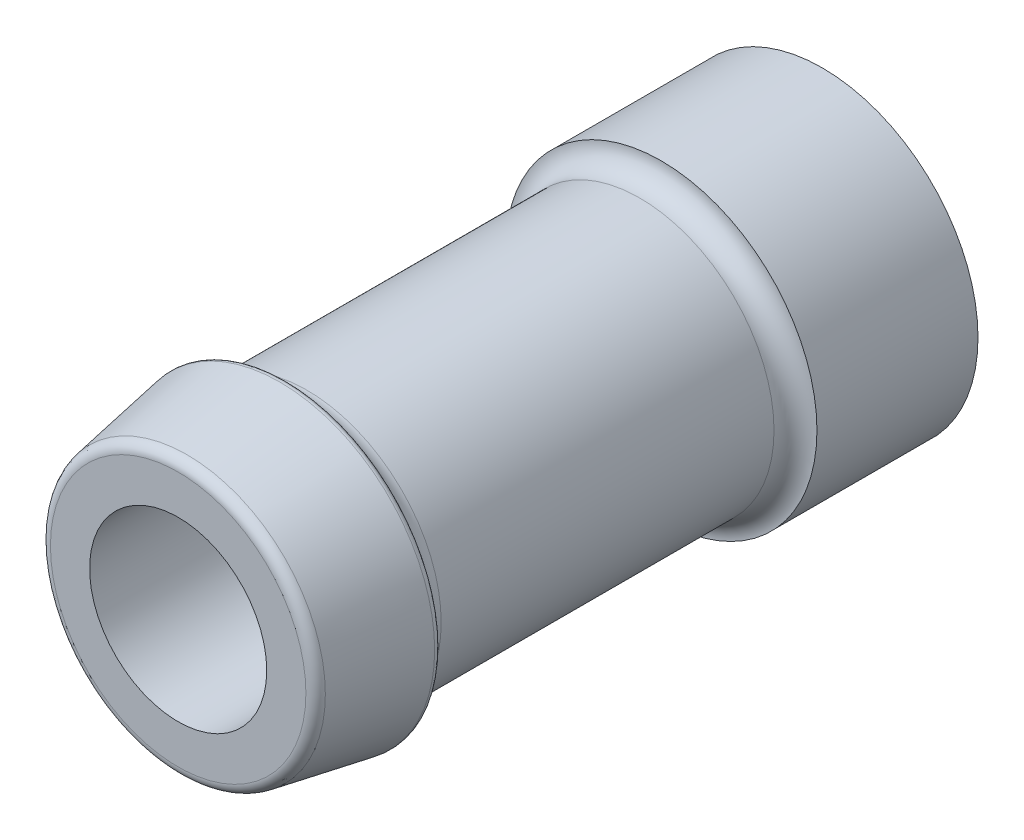
from build123d import *

# Parameters (mm, degrees)
SKETCH1_R           = 7.366
BOSS_EXTRUDE1_DEPTH = 30.48
SKETCH2_R           = 4.191
CUT_EXTRUDE1_DEPTH  = 30.48
CUT_EXTRUDE2_START  = -5.08
SKETCH3_R           = 10.16
SKETCH3_R_2         = 6.35
CUT_EXTRUDE2_DEPTH  = 17.78
FILLET1_R           = 1.016
FILLET2_R           = 1.016
CHAMFER1_SIZE       = 5.08
CHAMFER1_SIZE_2     = 0.895741062
FILLET3_R           = 0.508
FILLET4_R           = 0.254


# Some blends are built 0.0001 mm under size
with BuildPart() as part:
    # Sketch1 → Boss-Extrude1 (new body)
    with BuildSketch(Plane.XY):
        with Locations(Location((0, 0, 0), (0, 0, 180))):
            Circle(SKETCH1_R)
    extrude(amount=BOSS_EXTRUDE1_DEPTH)

    # Sketch2 → Cut-Extrude1 (cut)
    with BuildSketch(Plane.XY.offset(30.48)):
        Circle(SKETCH2_R)
    extrude(amount=-CUT_EXTRUDE1_DEPTH, mode=Mode.SUBTRACT)

    # Sketch3 → Cut-Extrude2 (cut)
    with BuildSketch(Plane.XY.offset(30.48).offset(CUT_EXTRUDE2_START)):
        Circle(SKETCH3_R)
        Circle(SKETCH3_R_2, mode=Mode.SUBTRACT)
    extrude(amount=-CUT_EXTRUDE2_DEPTH, mode=Mode.SUBTRACT)

    # Fillet1
    fillet1_edges = [part.edges().sort_by_distance(p)[0] for p in [
        (-6.35, 0, 7.62),
    ]]
    fillet(fillet1_edges, radius=FILLET1_R - 0.0001)  # a hair under: the kernel refuses the full size

    # Fillet2
    fillet2_edges = [part.edges().sort_by_distance(p)[0] for p in [
        (-6.35, 0, 25.4),
    ]]
    fillet(fillet2_edges, radius=FILLET2_R - 0.0001)  # a hair under: the kernel refuses the full size

    # Chamfer1
    # the kernel refuses this chamfer: 5.08, 0.895741062 mm, written as the material it takes off along each edge
    with BuildSketch(Plane(origin=(0, 0, 30.48), x_dir=(-1, 0, 0), z_dir=(0, 1, 0))) as chamfer1_piece_1:
        Polygon((7.366, -CHAMFER1_SIZE), (7.366 - CHAMFER1_SIZE_2, 0), (7.366, 0), align=None)
    revolve(axis=Axis((0, 0, 30.48), (0, 0, 1)), mode=Mode.SUBTRACT)

    # Fillet3
    fillet3_edges = [part.edges().sort_by_distance(p)[0] for p in [
        (6.470258938, 0, 30.48),
    ]]
    fillet(fillet3_edges, radius=FILLET3_R)

    # Fillet4
    fillet4_edges = [part.edges().sort_by_distance(p)[0] for p in [
        (7.366, 0, 25.4),
    ]]
    fillet(fillet4_edges, radius=FILLET4_R)


solid = part.part
